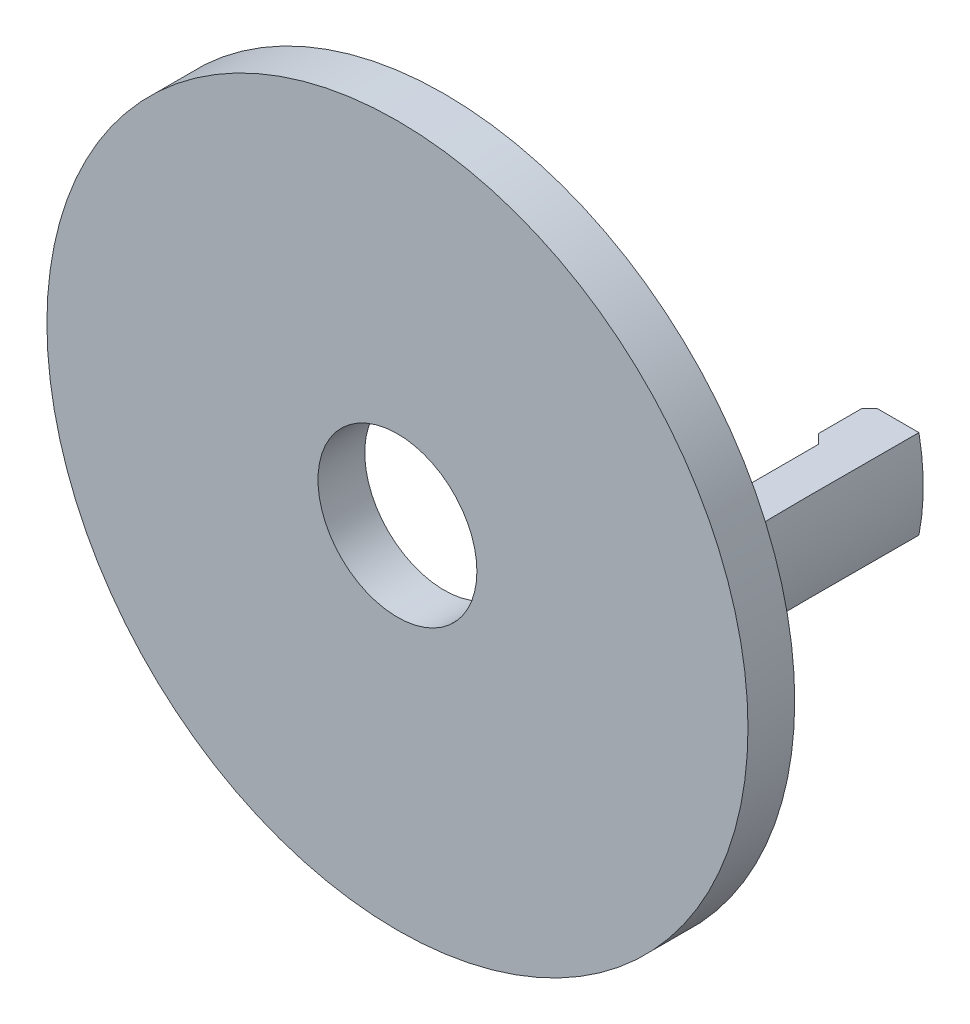
from build123d import *

# Parameters (mm, degrees)
GUARD_BASE_SKETCH_R      = 37.5
GUARD_DEPTH              = 5
INNER_AXLE_BASE_SKETCH_R = 8.5
INNER_AXLE_HOLE_DEPTH    = 54.268189382
COUPLING_TOOTH_DEPTH     = 4.75


with BuildPart() as part:
    # Guard base sketch → Guard (new body)
    with BuildSketch(Plane.XY):
        Circle(GUARD_BASE_SKETCH_R)
    extrude(amount=GUARD_DEPTH)

    # Inner axle base sketch → Inner axle hole (cut, through all)
    with BuildSketch(Plane.XY.offset(5)):
        Circle(INNER_AXLE_BASE_SKETCH_R)
    extrude(amount=-INNER_AXLE_HOLE_DEPTH, mode=Mode.SUBTRACT)

    # Coupling tooth base sketch → Coupling tooth (add, symmetric)
    with BuildSketch(Plane(origin=(0, 0, 0), x_dir=(1, 0, 0), z_dir=(0, 1, 0))):
        with BuildLine():
            Line((16.853553391, 0), (26, 0))
            add(Edge.make_bspline(
                [(24.5, 26.75), (24.5, 22.72818992), (24.490050178, 20.542467854), (24.51194908, 14.942357728), (24.274871471, 4.983935506), (26, 0)],
                knots=[0, 0, 0, 0, 0.44660472, 0.54660472, 1, 1, 1, 1], degree=3))
            Line((24.5, 26.75), (19.603553391, 26.75))
            Line((19.603553391, 26.75), (18.75, 25.896446609))
            Line((18.75, 25.896446609), (18.75, 21.310660172))
            Line((18.75, 21.310660172), (19.75, 20.310660172))
            Line((19.75, 20.310660172), (19.75, 2.896446609))
            Line((19.75, 2.896446609), (16.853553391, 0))
        make_face()
    coupling_tooth = extrude(amount=COUPLING_TOOTH_DEPTH, both=True)

    # Sketch6<4> → Circularity cut (revolve, cut)
    with BuildSketch(Plane(origin=(0, 0, 0), x_dir=(1, 0, 0), z_dir=(0, 1, 0))):
        with BuildLine():
            add(Edge.make_bspline(
                [(24.5, 26.75), (24.5, 22.72818992), (24.490050178, 20.542467854), (24.51194908, 14.942357728), (24.274871471, 4.983935506), (26, 0)],
                knots=[0, 0, 0, 0, 0.44660472, 0.54660472, 1, 1, 1, 1], degree=3))
            Line((26, 0), (37.5, 0))
            Line((37.5, 0), (37.5, 26.75))
            Line((37.5, 26.75), (24.5, 26.75))
        make_face()
    circularity_cut = revolve(axis=Axis((0, 0, 0), (0, 0, -1)), mode=Mode.SUBTRACT)

    # Coupling teeth: Coupling tooth, Circularity cut across plane
    add(coupling_tooth.mirror(Plane(origin=(0, 0, 0), x_dir=(0, 0, 1), z_dir=(1, 0, 0))))
    add(circularity_cut.mirror(Plane(origin=(0, 0, 0), x_dir=(0, 0, 1), z_dir=(1, 0, 0))), mode=Mode.SUBTRACT)


solid = part.part
